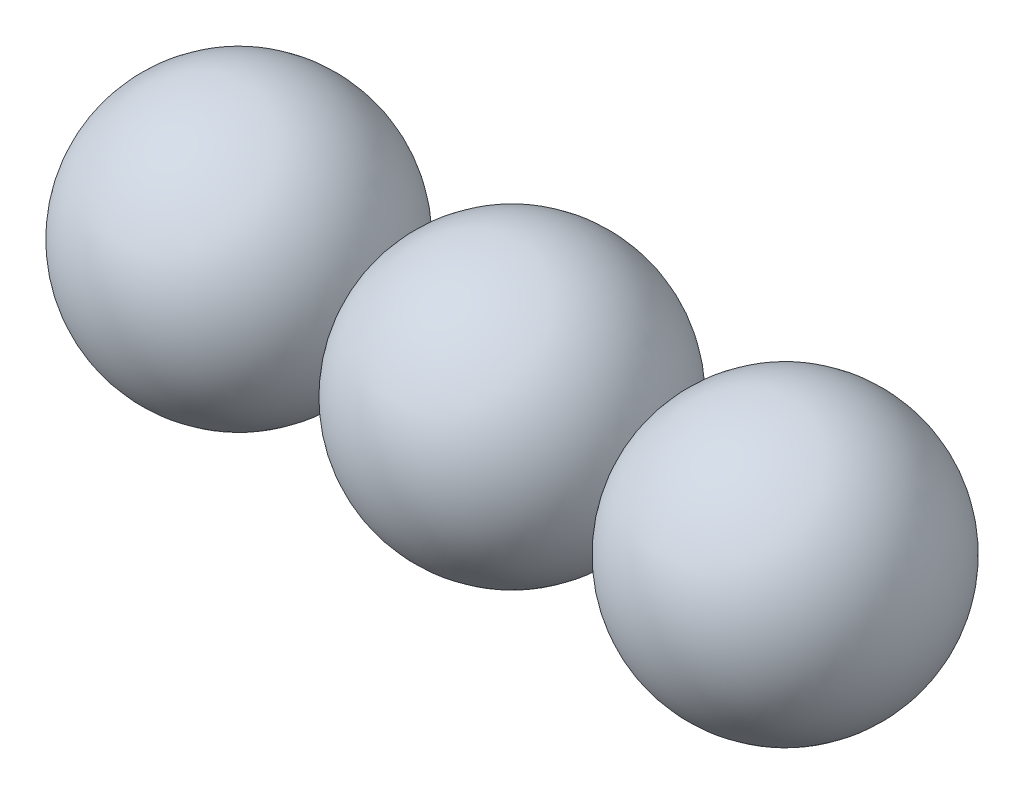
from build123d import *


with BuildPart() as part:
    # 草圖1 → 旋轉1 (revolve)
    with BuildSketch(Plane.XY):
        with BuildLine():
            ThreePointArc((0, -30), (30, 0), (0, 30))
            Line((0, 30), (0, -30))
        make_face()
    revolve(axis=Axis((0, 30, 0), (0, -1, 0)))


with BuildPart() as body_2:
    # 草圖1<8> → 旋轉2 (revolve)
    with BuildSketch(Plane.XY):
        with BuildLine():
            ThreePointArc((60, -30), (90, 0), (60, 30))
            Line((60, 30), (60, -30))
        make_face()
    revolve(axis=Axis((60, 30, 0), (0, -1, 0)))


with BuildPart() as body_3:
    # 草圖1<9> → 旋轉3 (revolve)
    with BuildSketch(Plane.XY):
        with BuildLine():
            ThreePointArc((150, 0), (141.213203436, 21.213203436), (120, 30))
            Line((120, 30), (120, -30))
            ThreePointArc((120, -30), (141.213203436, -21.213203436), (150, 0))
        make_face()
    revolve(axis=Axis((120, -30, 0), (0, -1, 0)))


solid = Compound([part.part, body_2.part, body_3.part])
